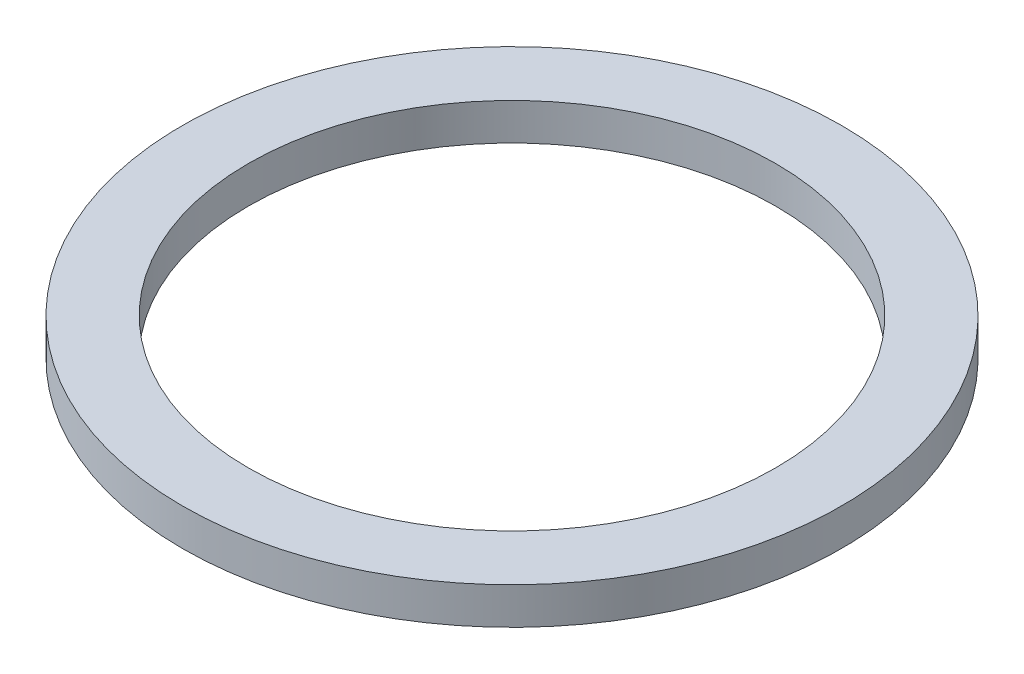
from build123d import *

# Parameters (mm, degrees)
SKETCH1_R           = 62.5
BOSS_EXTRUDE1_DEPTH = 7
SKETCH2_R           = 50
CUT_EXTRUDE1_DEPTH  = 89.665100237


with BuildPart() as part:
    # Sketch1 → Boss-Extrude1 (new body)
    with BuildSketch(Plane(origin=(0, 0, 0), x_dir=(1, 0, 0), z_dir=(0, 1, 0))):
        Circle(SKETCH1_R)
    extrude(amount=BOSS_EXTRUDE1_DEPTH)

    # Sketch2 → Cut-Extrude1 (cut, through all)
    with BuildSketch(Plane(origin=(0, 0, 0), x_dir=(1, 0, 0), z_dir=(0, 1, 0))):
        Circle(SKETCH2_R)
    extrude(amount=CUT_EXTRUDE1_DEPTH, mode=Mode.SUBTRACT)


solid = part.part
